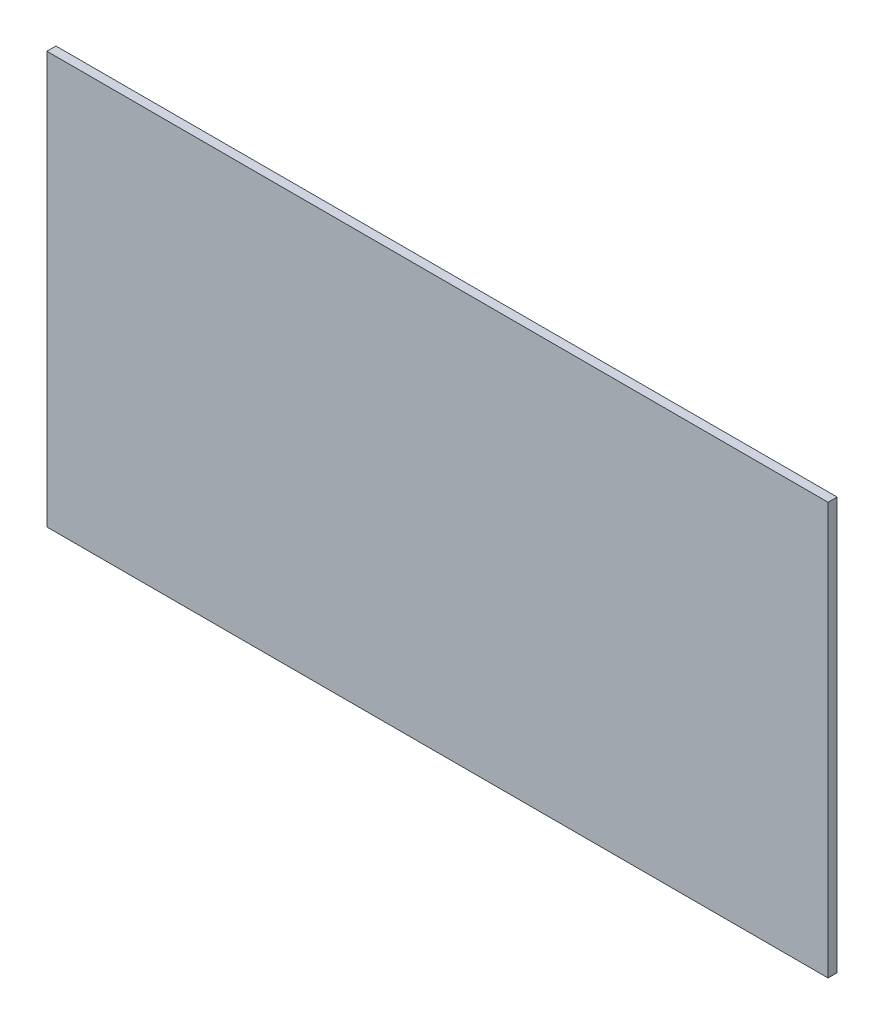
from build123d import *

# Parameters (mm, degrees)
SKETCH1_W          = 229.1969
SKETCH1_H          = 120.88368
BASE_FLANGE1_DEPTH = 2.65684


# Sheet-metal steps are written as plain solids
with BuildPart() as part:
    # Sketch1 → Base-Flange1 (new body)
    with BuildSketch(Plane.XY):
        with Locations((114.59845, 60.44184)):
            Rectangle(SKETCH1_W, SKETCH1_H)
    extrude(amount=-BASE_FLANGE1_DEPTH)


solid = part.part
